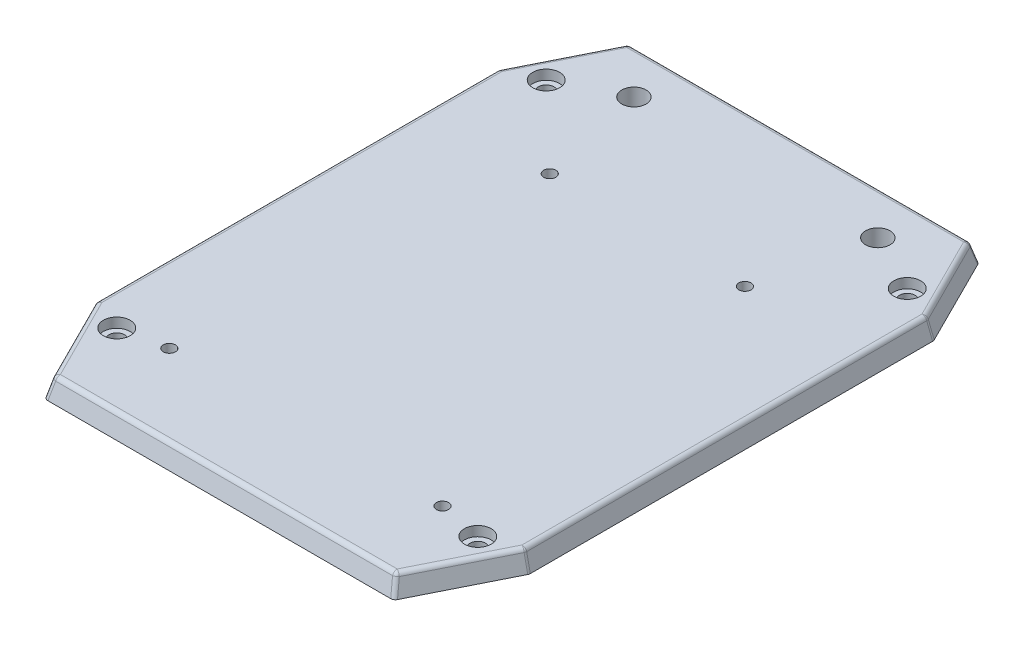
from build123d import *

# Parameters (mm, degrees)
BOSS_EXTRUDE1_DEPTH     = 2
CHAMFER1_SIZE           = 4
CHAMFER1_SIZE_2         = 1.200057511
SKETCH2_R               = 1.6
CUT_EXTRUDE1_DEPTH      = 76.106590923
SKETCH3_R               = 2.75
CUT_EXTRUDE2_DEPTH      = 2
MIRROR2_COPY_1_SKETCH_R = 1.6
MIRROR2_COPY_1_DEPTH    = 76.106590923
MIRROR2_COPY_2_SKETCH_R = 2.75
MIRROR2_COPY_2_DEPTH    = 2
FILLET1_R               = 1
SKETCH4_R               = 1.25
CUT_EXTRUDE3_DEPTH      = 76.106590923
SKETCH5_R               = 2.5
CUT_EXTRUDE4_DEPTH      = 76.106590923


with BuildPart() as part:
    # Sketch1 → Boss-Extrude1 (new, symmetric)
    with BuildSketch(Plane(origin=(0, 0, 0), x_dir=(1, 0, 0), z_dir=(0, 1, 0))):
        Polygon((-45, -41.45898034), (-35.72949017, -60), (35.72949017, -60), (45, -41.45898034), (45, 41.45898034), (35.72949017, 60), (-35.72949017, 60), (-45, 41.45898034), align=None)
    extrude(amount=BOSS_EXTRUDE1_DEPTH, both=True)

    # Chamfer1
    # the kernel refuses this chamfer: 4, 1.200057511 mm, written as the material it takes off along each edge
    with BuildSketch(Plane(origin=(-31.085729195, 2, -69.28752195), x_dir=(-0.0099009581726386, -0.9999387300150343, -0.004950479086319294), z_dir=(-0.44721359549995754, 0, 0.8944271909999161)), Plane(origin=(49.643760975, 2, -32.17145839), x_dir=(0.009900958172639964, -0.9999387300150343, -0.004950479086319981), z_dir=(-0.4472135954999578, 0, -0.894427190999916)), Plane(origin=(31.085729195, 2, 69.28752195), x_dir=(0.009900958172639964, -0.9999387300150343, 0.004950479086319981), z_dir=(0.4472135954999578, 0, -0.894427190999916)), Plane(origin=(-49.643760975, 2, 32.17145839), x_dir=(-0.009900958172639964, -0.9999387300150343, 0.004950479086319981), z_dir=(0.4472135954999578, 0, 0.894427190999916))) as chamfer1_piece_1:
        Polygon((CHAMFER1_SIZE * 0.999938730015, CHAMFER1_SIZE * 0.0110696077582), (-CHAMFER1_SIZE_2 * 0.0110696077607, CHAMFER1_SIZE_2 * 0.999938730237), (0, 0), align=None)
    extrude(amount=41.497020588, mode=Mode.SUBTRACT)
    with BuildSketch(Plane(origin=(46.113255381, 2, -60), x_dir=(0, -0.9999387300150343, -0.011069607758202806), z_dir=(-1, 0, 0))) as chamfer1_piece_2:
        Polygon((CHAMFER1_SIZE * 0.999938730015, CHAMFER1_SIZE * 0.0110696077582), (-CHAMFER1_SIZE_2 * 0.0110696077607, CHAMFER1_SIZE_2 * 0.999938730237), (0, 0), align=None)
    extrude(amount=92.226510762, mode=Mode.SUBTRACT)
    with BuildSketch(Plane(origin=(45, 2, 51.842745551), x_dir=(0.011069607758202806, -0.9999387300150343, 0), z_dir=(0, 0, -1)), Plane(origin=(-45, 2, -51.842745551), x_dir=(-0.011069607758202806, -0.9999387300150343, 0), z_dir=(0, 0, 1))) as chamfer1_piece_3:
        Polygon((CHAMFER1_SIZE * 0.999938730015, CHAMFER1_SIZE * 0.0110696077582), (-CHAMFER1_SIZE_2 * 0.0110696077607, CHAMFER1_SIZE_2 * 0.999938730237), (0, 0), align=None)
    extrude(amount=103.685491102, mode=Mode.SUBTRACT)
    with BuildSketch(Plane(origin=(-46.113255381, 2, 60), x_dir=(0, 0.12207157319780508, -0.9925213000319), z_dir=(1, 0, 0))) as chamfer1_piece_4:
        Polygon((CHAMFER1_SIZE_2 * 0.992521300252, -CHAMFER1_SIZE_2 * 0.122071573225), (-CHAMFER1_SIZE * 0.122071573198, -CHAMFER1_SIZE * 0.992521300032), (0, 0), align=None)
    extrude(amount=92.226510762, mode=Mode.SUBTRACT)

    # Sketch2 → Cut-Extrude1 (cut, through all)
    with BuildSketch(Plane.XZ.offset(2)):
        with Locations(Location((-37.010643118, 44.021286236, 0), (0, 0, 270))):
            Circle(SKETCH2_R)
    cut_extrude1 = extrude(amount=-CUT_EXTRUDE1_DEPTH, mode=Mode.SUBTRACT)

    # Sketch3 → Cut-Extrude2 (cut)
    with BuildSketch(Plane(origin=(0, 2, 0), x_dir=(1, 0, 0), z_dir=(0, 1, 0))):
        with Locations(Location((-37.010643118, -44.021286236, 0), (0, 0, 270))):
            Circle(SKETCH3_R)
    cut_extrude2 = extrude(amount=-CUT_EXTRUDE2_DEPTH, mode=Mode.SUBTRACT)

    # Mirror1: Cut-Extrude1, Cut-Extrude2 across plane
    add(cut_extrude1.mirror(Plane(origin=(0, 0, 0), x_dir=(0, 0, 1), z_dir=(1, 0, 0))), mode=Mode.SUBTRACT)
    add(cut_extrude2.mirror(Plane(origin=(0, 0, 0), x_dir=(0, 0, 1), z_dir=(1, 0, 0))), mode=Mode.SUBTRACT)

    # Mirror2: Cut-Extrude1, Cut-Extrude2 across plane
    add(cut_extrude1.mirror(Plane.XY), mode=Mode.SUBTRACT)
    add(cut_extrude2.mirror(Plane.XY), mode=Mode.SUBTRACT)

    # Mirror2 copy 1 sketch → Mirror2 copy 1 (cut, through all)
    with BuildSketch(Plane(origin=(0, -2, 0), x_dir=(-1, 0, 0), z_dir=(0, -1, 0))):
        with Locations(Location((-37.010643118, 44.021286236, 0), (0, 0, 270))):
            Circle(MIRROR2_COPY_1_SKETCH_R)
    extrude(amount=-MIRROR2_COPY_1_DEPTH, mode=Mode.SUBTRACT)

    # Mirror2 copy 2 sketch → Mirror2 copy 2 (cut)
    with BuildSketch(Plane(origin=(0, 2, 0), x_dir=(-1, 0, 0), z_dir=(0, 1, 0))):
        with Locations(Location((-37.010643118, -44.021286236, 0), (0, 0, 270))):
            Circle(MIRROR2_COPY_2_SKETCH_R)
    extrude(amount=-MIRROR2_COPY_2_DEPTH, mode=Mode.SUBTRACT)

    # Fillet1
    fillet1_edges = [part.edges().sort_by_distance(p)[0] for p in [
        (-43.799942489, 2, 0),
        (-39.393878164, 2, 49.98781384),
        (0, 2, 58.799942489),
        (39.393878164, 2, 49.98781384),
        (43.799942489, 2, 0),
        (39.393878164, 2, -49.98781384),
        (0, 2, -58.799942489),
        (-39.393878164, 2, -49.98781384),
        (44.399971244, 0, 41.317332765),
        (35.358652005, 0, 59.399971244),
        (44.399971244, 0, -41.317332765),
        (-35.358652005, 0, 59.399971244),
        (35.358652005, 0, -59.399971244),
        (-44.399971244, 0, 41.317332765),
        (-35.358652005, 0, -59.399971244),
        (-44.399971244, 0, -41.317332765),
    ]]
    fillet(fillet1_edges, radius=FILLET1_R)

    # Sketch4 → Cut-Extrude3 (cut, through all)
    with BuildSketch(Plane(origin=(0, 2, 0), x_dir=(1, 0, 0), z_dir=(0, 1, 0))):
        with Locations(Location((-20, 27.75, 0), (0, 0, 270))):
            Circle(SKETCH4_R)
        with Locations(Location((-28, -42.25, 0), (0, 0, 270))):
            Circle(SKETCH4_R)
        with Locations(Location((20, 27.75, 0), (0, 0, 270))):
            Circle(SKETCH4_R)
        with Locations(Location((28, -42.25, 0), (0, 0, 270))):
            Circle(SKETCH4_R)
    extrude(amount=-CUT_EXTRUDE3_DEPTH, mode=Mode.SUBTRACT)

    # Sketch5 → Cut-Extrude4 (cut, through all)
    with BuildSketch(Plane.XZ.offset(2)):
        with Locations(Location((25, -50, 0), (0, 0, 270))):
            Circle(SKETCH5_R)
        with Locations(Location((-25, -50, 0), (0, 0, 270))):
            Circle(SKETCH5_R)
    extrude(amount=-CUT_EXTRUDE4_DEPTH, mode=Mode.SUBTRACT)


solid = part.part
